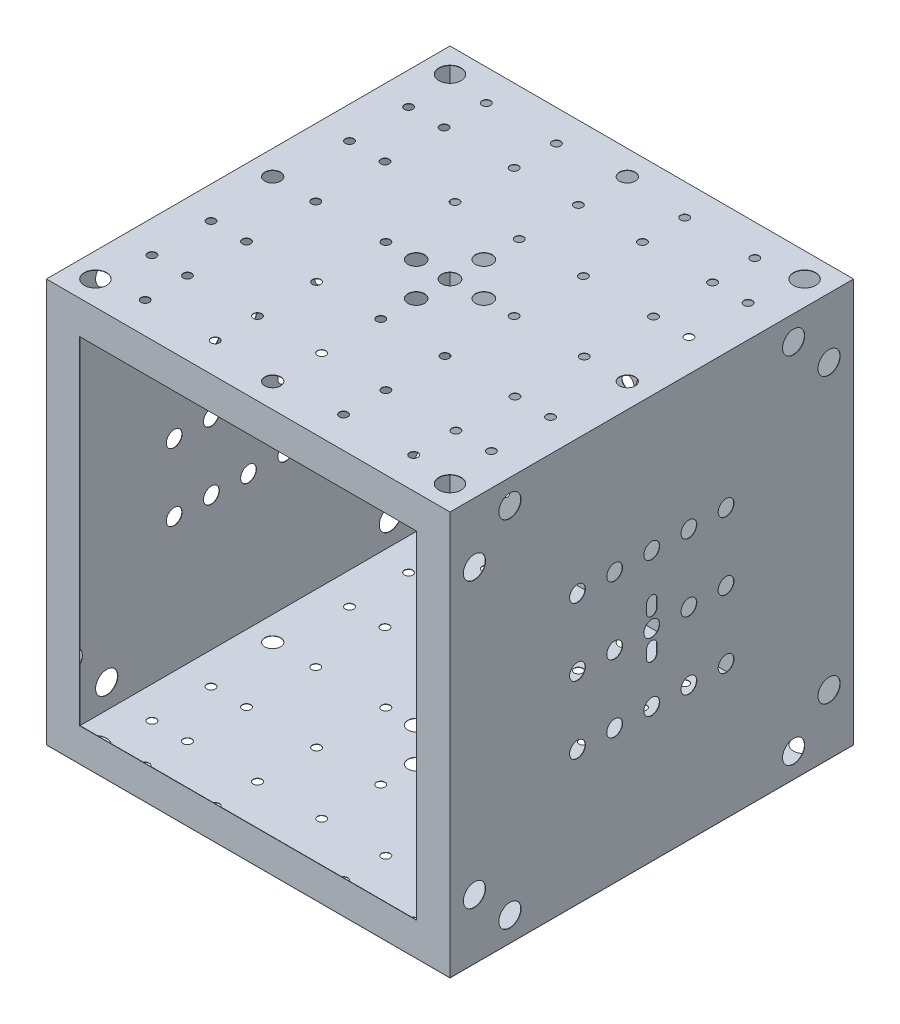
from build123d import *

# Parameters (mm, degrees)
SKETCH1_W           = 2390
SKETCH1_H           = 2390
BOSS_EXTRUDE1_DEPTH = 2390
SKETCH7_W           = 2386
SKETCH7_H           = 2386
CUT_EXTRUDE2_DEPTH  = 2388
SKETCH10_W          = 2390
SKETCH10_H          = 2388
SKETCH10_W_2        = 1995.67001675
SKETCH10_H_2        = 1996
BOSS_EXTRUDE4_DEPTH = 2
SKETCH11_R          = 49.85
SKETCH11_R_2        = 25
SKETCH11_R_3        = 46.75
SKETCH11_R_4        = 65.8
CUT_EXTRUDE3_DEPTH  = 2928.140242626
SKETCH12_R          = 91.2
SKETCH12_R_2        = 35.635
SKETCH12_R_3        = 65.8
CUT_EXTRUDE4_DEPTH  = 3586
SKETCH13_R          = 46.75
SKETCH13_R_2        = 65.8
CUT_EXTRUDE5_DEPTH  = 3586


with BuildPart() as part:
    # Sketch1 → Boss-Extrude1 (new body)
    with BuildSketch(Plane(origin=(0, 0, 0), x_dir=(1, 0, 0), z_dir=(0, 1, 0))):
        Rectangle(SKETCH1_W, SKETCH1_H)
    extrude(amount=BOSS_EXTRUDE1_DEPTH)

    # Sketch7 → Cut-Extrude2 (cut)
    with BuildSketch(Plane.XY.offset(1195)):
        with Locations((0, 1195)):
            Rectangle(SKETCH7_W, SKETCH7_H)
    extrude(amount=-CUT_EXTRUDE2_DEPTH, mode=Mode.SUBTRACT)

    # Sketch10 → Boss-Extrude4 (add)
    with BuildSketch(Plane.XY.offset(1195)):
        with Locations((0, 1194)):
            Rectangle(SKETCH10_W, SKETCH10_H)
        with Locations((0, 1195)):
            Rectangle(SKETCH10_W_2, SKETCH10_H_2, mode=Mode.SUBTRACT)
    extrude(amount=-BOSS_EXTRUDE4_DEPTH)

    # Sketch11 → Cut-Extrude3 (cut, through all)
    with BuildSketch(Plane(origin=(0, 2390, 0), x_dir=(1, 0, 0), z_dir=(0, 1, 0))):
        Circle(SKETCH11_R)
        with Locations((200, 0)):
            Circle(SKETCH11_R)
        with Locations((-200, 0)):
            Circle(SKETCH11_R)
        with Locations((0, 200)):
            Circle(SKETCH11_R)
        with Locations((0, -200)):
            Circle(SKETCH11_R)
        with Locations((-380, 0)):
            Circle(SKETCH11_R_2)
        with Locations((-795, 0)):
            Circle(SKETCH11_R_2)
        with Locations((-1050, 0)):
            Circle(SKETCH11_R_3)
        with Locations((-1050, 1050)):
            Circle(SKETCH11_R_4)
        with Locations((380, 0)):
            Circle(SKETCH11_R_2)
        with Locations((795, 0)):
            Circle(SKETCH11_R_2)
        with Locations((1050, 0)):
            Circle(SKETCH11_R_3)
        with Locations((1050, 1050)):
            Circle(SKETCH11_R_4)
        with Locations((-380, 410)):
            Circle(SKETCH11_R_2)
        with Locations((-795, 410)):
            Circle(SKETCH11_R_2)
        with Locations((380, 410)):
            Circle(SKETCH11_R_2)
        with Locations((795, 410)):
            Circle(SKETCH11_R_2)
        with Locations((0, 410)):
            Circle(SKETCH11_R_2)
        with Locations((-795, 760)):
            Circle(SKETCH11_R_2)
        with Locations((-380, 760)):
            Circle(SKETCH11_R_2)
        with Locations((0, 760)):
            Circle(SKETCH11_R_2)
        with Locations((380, 760)):
            Circle(SKETCH11_R_2)
        with Locations((795, 760)):
            Circle(SKETCH11_R_2)
        with Locations((-795, 1010)):
            Circle(SKETCH11_R_2)
        with Locations((-380, 1010)):
            Circle(SKETCH11_R_2)
        with Locations((380, 1010)):
            Circle(SKETCH11_R_2)
        with Locations((795, 1010)):
            Circle(SKETCH11_R_2)
        with Locations((0, 1050)):
            Circle(SKETCH11_R_3)
        with Locations((-1005, 760)):
            Circle(SKETCH11_R_2)
        with Locations((-1005, 410)):
            Circle(SKETCH11_R_2)
        with Locations((1005, 410)):
            Circle(SKETCH11_R_2)
        with Locations((1005, 760)):
            Circle(SKETCH11_R_2)
        with Locations((1005, -410)):
            Circle(SKETCH11_R_2)
        with Locations((795, -410)):
            Circle(SKETCH11_R_2)
        with Locations((380, -410)):
            Circle(SKETCH11_R_2)
        with Locations((0, -410)):
            Circle(SKETCH11_R_2)
        with Locations((-380, -410)):
            Circle(SKETCH11_R_2)
        with Locations((-795, -410)):
            Circle(SKETCH11_R_2)
        with Locations((-1005, -410)):
            Circle(SKETCH11_R_2)
        with Locations((-1005, -760)):
            Circle(SKETCH11_R_2)
        with Locations((-795, -760)):
            Circle(SKETCH11_R_2)
        with Locations((-380, -760)):
            Circle(SKETCH11_R_2)
        with Locations((0, -760)):
            Circle(SKETCH11_R_2)
        with Locations((380, -760)):
            Circle(SKETCH11_R_2)
        with Locations((795, -760)):
            Circle(SKETCH11_R_2)
        with Locations((1005, -760)):
            Circle(SKETCH11_R_2)
        with Locations((1050, -1050)):
            Circle(SKETCH11_R_4)
        with Locations((795, -1010)):
            Circle(SKETCH11_R_2)
        with Locations((380, -1010)):
            Circle(SKETCH11_R_2)
        with Locations((0, -1050)):
            Circle(SKETCH11_R_3)
        with Locations((-380, -1010)):
            Circle(SKETCH11_R_2)
        with Locations((-795, -1010)):
            Circle(SKETCH11_R_2)
        with Locations((-1050, -1050)):
            Circle(SKETCH11_R_4)
    extrude(amount=-CUT_EXTRUDE3_DEPTH, mode=Mode.SUBTRACT)

    # Sketch12 → Cut-Extrude4 (cut, through all)
    with BuildSketch(Plane(origin=(0, 0, -1195), x_dir=(-1, 0, 0), z_dir=(0, 0, -1))):
        with Locations((0, 1195)):
            Circle(SKETCH12_R)
        with Locations((0, 1335)):
            Circle(SKETCH12_R_2)
        with Locations((-900, 2095)):
            Circle(SKETCH12_R_3)
        with Locations((-222, 1577)):
            Circle(SKETCH12_R)
        with Locations((222, 813)):
            Circle(SKETCH12_R)
        with Locations((900, 2095)):
            Circle(SKETCH12_R_3)
        with Locations((900, 295)):
            Circle(SKETCH12_R_3)
        with Locations((-900, 295)):
            Circle(SKETCH12_R_3)
        with Locations((-140, 1195)):
            Circle(SKETCH12_R_2)
        with Locations((0, 1055)):
            Circle(SKETCH12_R_2)
        with Locations((140, 1195)):
            Circle(SKETCH12_R_2)
    extrude(amount=-CUT_EXTRUDE4_DEPTH, mode=Mode.SUBTRACT)

    # Sketch13 → Cut-Extrude5 (cut, through all)
    with BuildSketch(Plane.ZY.offset(1195)):
        with Locations((0, 1195)):
            Circle(SKETCH13_R)
        with Locations((0, 1595)):
            Circle(SKETCH13_R)
        with Locations((-220, 1595)):
            Circle(SKETCH13_R)
        with Locations((-220, 1195)):
            Circle(SKETCH13_R)
        with Locations((-440, 1595)):
            Circle(SKETCH13_R)
        with Locations((-440, 1195)):
            Circle(SKETCH13_R)
        with Locations((-840, 2245)):
            Circle(SKETCH13_R_2)
        with Locations((-1050, 2035)):
            Circle(SKETCH13_R_2)
        with Locations((220, 1595)):
            Circle(SKETCH13_R)
        with Locations((220, 1195)):
            Circle(SKETCH13_R)
        with Locations((440, 1195)):
            Circle(SKETCH13_R)
        with Locations((440, 1595)):
            Circle(SKETCH13_R)
        with Locations((840, 2245)):
            Circle(SKETCH13_R_2)
        with Locations((1050, 2035)):
            Circle(SKETCH13_R_2)
        with Locations((-440, 795)):
            Circle(SKETCH13_R)
        with Locations((-220, 795)):
            Circle(SKETCH13_R)
        with Locations((0, 795)):
            Circle(SKETCH13_R)
        with Locations((220, 795)):
            Circle(SKETCH13_R)
        with Locations((440, 795)):
            Circle(SKETCH13_R)
        with Locations((1050, 355)):
            Circle(SKETCH13_R_2)
        with Locations((840, 145)):
            Circle(SKETCH13_R_2)
        with Locations((-840, 145)):
            Circle(SKETCH13_R_2)
        with Locations((-1050, 355)):
            Circle(SKETCH13_R_2)
        with BuildLine():
            Line((30.937501554, 1055.000002025), (30.937498446, 1102.500002025))
            ThreePointArc((30.937498446, 1102.500002025), (-3.579e-06, 1133.4375), (-30.937501554, 1102.499997975))
            Line((-30.937501554, 1102.499997975), (-30.937498446, 1054.999997975))
            ThreePointArc((-30.937498446, 1054.999997975), (3.579e-06, 1024.0625), (30.937501554, 1055.000002025))
        make_face()
        with BuildLine():
            Line((30.937501554, 1334.999997975), (30.937498446, 1287.499997975))
            ThreePointArc((30.937498446, 1287.499997975), (-3.579e-06, 1256.5625), (-30.937501554, 1287.500002025))
            Line((-30.937501554, 1287.500002025), (-30.937498446, 1335.000002025))
            ThreePointArc((-30.937498446, 1335.000002025), (3.579e-06, 1365.9375), (30.937501554, 1334.999997975))
        make_face()
    extrude(amount=-CUT_EXTRUDE5_DEPTH, mode=Mode.SUBTRACT)


with BuildPart() as body_2:
    # Split1: the piece on the far side of the plane
    add(part.part)
    split(bisect_by=Plane(origin=(-1193, 2, -1193), x_dir=(0, 0, -1), z_dir=(0, -1, 0)), keep=Keep.BOTTOM)


with BuildPart() as part_1:
    add(part.part)

    # Split1
    split(bisect_by=Plane(origin=(-1193, 2, -1193), x_dir=(0, 0, -1), z_dir=(0, -1, 0)), keep=Keep.TOP)


solid = Compound([body_2.part, part_1.part])
